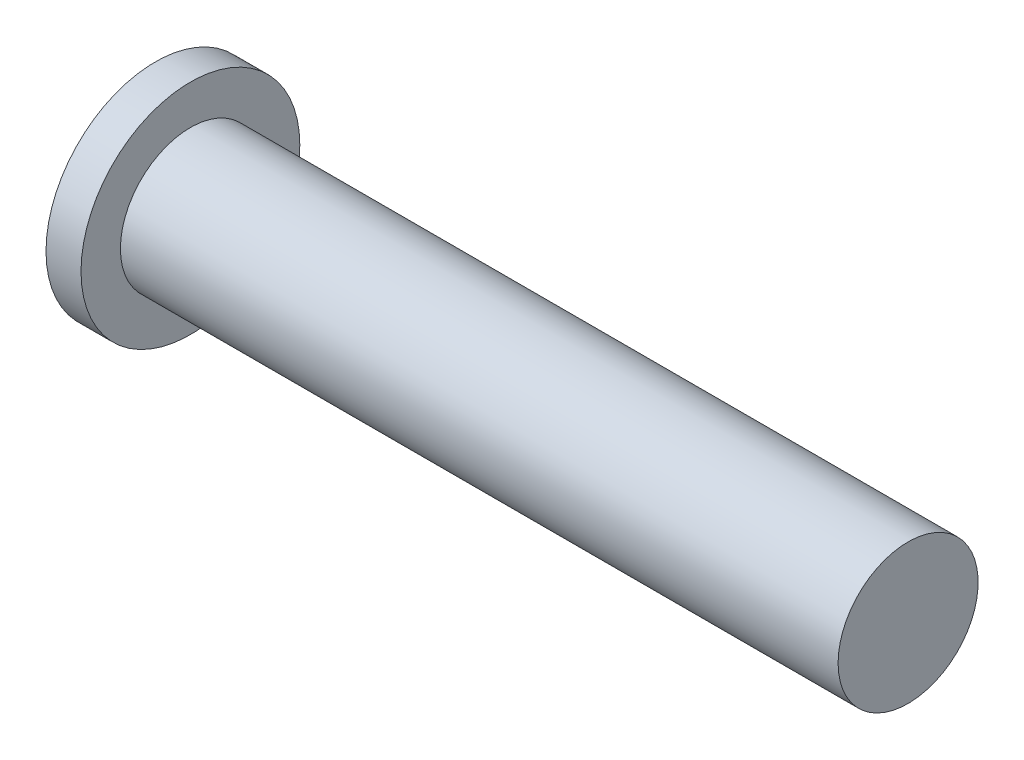
from build123d import *


with BuildPart() as part:
    # ｽｹｯﾁ1 → 回転1 (revolve)
    with BuildSketch(Plane(origin=(0, 0, 0), x_dir=(1, 0, 0), z_dir=(0, 1, 0))):
        Polygon((0, 0), (0, 6.25), (2, 6.25), (2, 4), (43, 4), (43, 0), align=None)
    revolve(axis=Axis((0, 0, 0), (1, 0, 0)))


solid = part.part
